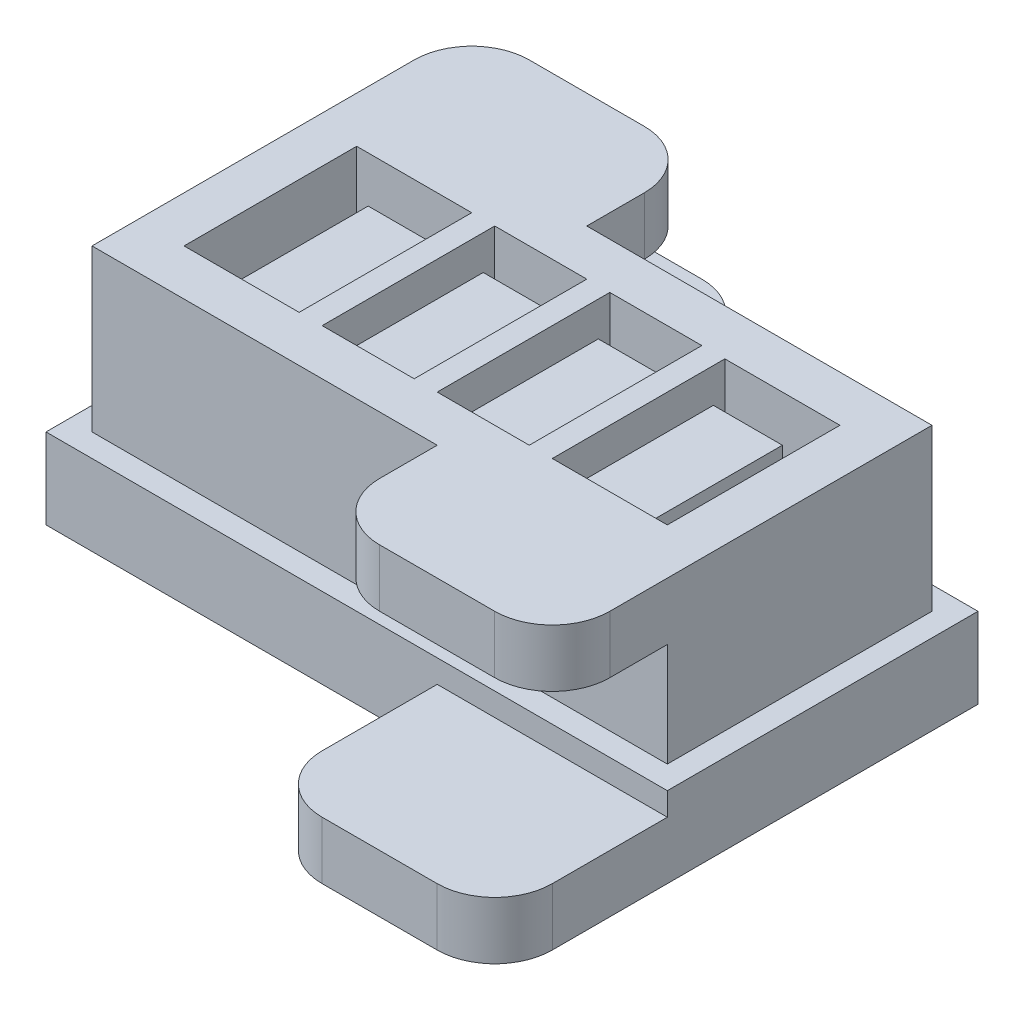
from build123d import *

# Parameters (mm, degrees)
SKETCH1_W                = 8
SKETCH1_H                = 15
BOSS_EXTRUDE1_DEPTH      = 15
SKETCH2_W                = 6
SKETCH2_H                = 11
CUT_EXTRUDE1_DEPTH       = 13
SKETCH3_W                = 15
SKETCH3_H                = 3
BOSS_EXTRUDE2_DEPTH      = 2
LPATTERN1_COUNT          = 4
LPATTERN1_PITCH          = 10
SKETCH4_W                = 15
SKETCH4_H                = 12
BOSS_EXTRUDE3_DEPTH      = 2
SKETCH5_W                = 15
SKETCH5_H                = 15
BOSS_EXTRUDE4_DEPTH      = 2
SKETCH6_W                = 36
SKETCH6_H                = 2
CUT_EXTRUDE2_DEPTH       = 2
SKETCH7_W                = 38
SKETCH7_H                = 13
SKETCH7_W_2              = 36
SKETCH7_H_2              = 11
BOSS_EXTRUDE5_DEPTH      = 2
SKETCH8_W                = 2
SKETCH8_H                = 2.5
BOSS_EXTRUDE6_DEPTH      = 2
LPATTERN2_COUNT          = 3
LPATTERN2_PITCH          = 10
BOSS_EXTRUDE7_DEPTH      = 15
BOSS_EXTRUDE7_DEPTH_BACK = 6
SKETCH9_W                = 50
SKETCH9_H                = 23
SPLIT1_START             = -6
SPLIT1_OUTLINE_W         = 50
SPLIT1_OUTLINE_H         = 23
SPLIT1_DEPTH             = 6
SPLIT1_2_OUTLINE_W       = 6
SPLIT1_2_OUTLINE_H       = 11
SPLIT1_2_DEPTH           = 13
SPLIT1_3_OUTLINE_W       = 4
SPLIT1_3_OUTLINE_H       = 2
SPLIT1_3_DEPTH           = 2
SPLIT1_START_2           = -13
SPLIT1_4_DEPTH           = 11
SPLIT1_START_3           = -19
SPLIT1_5_DEPTH           = 23
SPLIT1_6_OUTLINE_W       = 38
SPLIT1_6_OUTLINE_H       = 2
SPLIT1_6_DEPTH           = 5
SPLIT1_START_4           = -1
SPLIT1_7_OUTLINE_W       = 38
SPLIT1_7_OUTLINE_H       = 2
SPLIT1_7_DEPTH           = 5
SPLIT1_START_5           = -8.5
SPLIT1_8_DEPTH           = 2
SPLIT1_START_6           = -9.5
SPLIT1_9_OUTLINE_W       = 2
SPLIT1_9_OUTLINE_H       = 2
SPLIT1_9_DEPTH           = 4
SPLIT1_10_OUTLINE_W      = 2
SPLIT1_10_OUTLINE_H      = 2
SPLIT1_10_DEPTH          = 1
SPLIT1_START_7           = -3
SPLIT1_11_OUTLINE_W      = 2
SPLIT1_11_OUTLINE_H      = 2
SPLIT1_11_DEPTH          = 1
SKETCH11_W               = 20
SKETCH11_H               = 5
BOSS_EXTRUDE8_DEPTH      = 10
SKETCH12_W               = 20
SKETCH12_H               = 5
BOSS_EXTRUDE9_DEPTH      = 10
FILLET1_R                = 5
SKETCH13_W               = 54
SKETCH13_H               = 27
SKETCH13_W_2             = 50
SKETCH13_H_2             = 23
BOSS_EXTRUDE11_DEPTH     = 7
SKETCH14_W               = 20
SKETCH14_H               = 5
BOSS_EXTRUDE12_DEPTH     = 15
SKETCH15_W               = 20
SKETCH15_H               = 5
BOSS_EXTRUDE13_DEPTH     = 15
FILLET2_R                = 5


# Read off the part's stored shape, not the designer's step: Split1
with BuildPart() as part:
    # Sketch1 → Boss-Extrude1 (new body)
    with BuildSketch(Plane(origin=(0, 0, 0), x_dir=(1, 0, 0), z_dir=(0, 1, 0))):
        with Locations((4, 7.5)):
            Rectangle(SKETCH1_W, SKETCH1_H)
    extrude(amount=BOSS_EXTRUDE1_DEPTH)

    # Sketch2 → Cut-Extrude1 (cut)
    with BuildSketch(Plane.XZ):
        with Locations((4, -7.5)):
            Rectangle(SKETCH2_W, SKETCH2_H)
    extrude(amount=-CUT_EXTRUDE1_DEPTH, mode=Mode.SUBTRACT)

    # Sketch3 → Boss-Extrude2 (add)
    with BuildSketch(Plane.ZY):
        with Locations((-7.5, 1.5)):
            Rectangle(SKETCH3_W, SKETCH3_H)
    extrude(amount=BOSS_EXTRUDE2_DEPTH)


with BuildPart() as lpattern1_1:
    # LPattern1: pattern copy
    add(part.part.moved(Location(Vector(-1, 0, 0) * (1 * LPATTERN1_PITCH))))


with BuildPart() as lpattern1_2:
    # LPattern1: pattern copy
    add(part.part.moved(Location(Vector(-1, 0, 0) * (2 * LPATTERN1_PITCH))))


with BuildPart() as lpattern1_3:
    # LPattern1: pattern copy
    add(part.part.moved(Location(Vector(-1, 0, 0) * (3 * LPATTERN1_PITCH))))


with BuildPart() as lpattern1_2_1:
    add(lpattern1_2.part)

    # Combine1: union LPattern1_1, part, LPattern1_3
    add(lpattern1_1.part)
    add(part.part)
    add(lpattern1_3.part)

    # Sketch4 → Boss-Extrude3 (add)
    with BuildSketch(Plane.ZY.offset(30)):
        with Locations((-7.5, 9)):
            Rectangle(SKETCH4_W, SKETCH4_H)
    extrude(amount=BOSS_EXTRUDE3_DEPTH)

    # Sketch5 → Boss-Extrude4 (add)
    with BuildSketch(Plane(origin=(8, 0, 0), x_dir=(0, 0, -1), z_dir=(1, 0, 0))):
        with Locations((7.5, 7.5)):
            Rectangle(SKETCH5_W, SKETCH5_H)
    extrude(amount=BOSS_EXTRUDE4_DEPTH)

    # Sketch6 → Cut-Extrude2 (cut)
    with BuildSketch(Plane(origin=(0, 0, 0), x_dir=(-1, 0, 0), z_dir=(0, -1, 0))):
        with Locations((11, 7.5)):
            Rectangle(SKETCH6_W, SKETCH6_H)
    extrude(amount=-CUT_EXTRUDE2_DEPTH, mode=Mode.SUBTRACT)

    # Sketch7 → Boss-Extrude5 (add)
    with BuildSketch(Plane.XZ):
        with Locations((-11, -7.5)):
            Rectangle(SKETCH7_W, SKETCH7_H)
        with Locations((-11, -7.5)):
            Rectangle(SKETCH7_W_2, SKETCH7_H_2, mode=Mode.SUBTRACT)
    extrude(amount=BOSS_EXTRUDE5_DEPTH)

    # Sketch8 → Boss-Extrude6 (add)
    with BuildSketch(Plane.XZ):
        with Locations((-21, -10.75)):
            Rectangle(SKETCH8_W, SKETCH8_H)
        with Locations((-21, -4.25)):
            Rectangle(SKETCH8_W, SKETCH8_H)
    boss_extrude6 = extrude(amount=BOSS_EXTRUDE6_DEPTH)

    # LPattern2: Boss-Extrude6 ×3
    with Locations(*[(i * LPATTERN2_PITCH, 0, 0) for i in range(1, LPATTERN2_COUNT)]):
        add(boss_extrude6)


with BuildPart() as body_2:
    # Sketch9 → Boss-Extrude7 (new, two sides: drawn at the far end of the back side and taken through both)
    with BuildSketch(Plane(origin=(0, 0, 0), x_dir=(1, 0, 0), z_dir=(0, 1, 0)).offset(-BOSS_EXTRUDE7_DEPTH_BACK)):
        with Locations((-11, 7.5)):
            Rectangle(SKETCH9_W, SKETCH9_H)
    extrude(amount=BOSS_EXTRUDE7_DEPTH + BOSS_EXTRUDE7_DEPTH_BACK)

    # Combine2: cut LPattern1_2
    add(lpattern1_2_1.part, mode=Mode.SUBTRACT)

    # Split1 outline → Split1 (cut)
    with BuildSketch(Plane(origin=(0, 0, 0), x_dir=(1, 0, 0), z_dir=(0, 1, 0)).offset(SPLIT1_START)):
        with Locations((-11, 7.5)):
            Rectangle(SPLIT1_OUTLINE_W, SPLIT1_OUTLINE_H)
    extrude(amount=SPLIT1_DEPTH, mode=Mode.SUBTRACT)

    # Split1 2 outline → Split1 2 (cut)
    with BuildSketch(Plane(origin=(0, 0, 0), x_dir=(1, 0, 0), z_dir=(0, 1, 0))):
        with Locations((-26, 7.5)):
            Rectangle(SPLIT1_2_OUTLINE_W, SPLIT1_2_OUTLINE_H)
        with Locations((-16, 7.5)):
            Rectangle(SPLIT1_2_OUTLINE_W, SPLIT1_2_OUTLINE_H)
        with Locations((-6, 7.5)):
            Rectangle(SPLIT1_2_OUTLINE_W, SPLIT1_2_OUTLINE_H)
        with Locations((4, 7.5)):
            Rectangle(SPLIT1_2_OUTLINE_W, SPLIT1_2_OUTLINE_H)
    extrude(amount=SPLIT1_2_DEPTH, mode=Mode.SUBTRACT)

    # Split1 3 outline → Split1 3 (cut)
    with BuildSketch(Plane(origin=(0, 0, 0), x_dir=(1, 0, 0), z_dir=(0, 1, 0))):
        with Locations((-21, 7.5)):
            Rectangle(SPLIT1_3_OUTLINE_W, SPLIT1_3_OUTLINE_H)
        with Locations((-11, 7.5)):
            Rectangle(SPLIT1_3_OUTLINE_W, SPLIT1_3_OUTLINE_H)
        with Locations((-1, 7.5)):
            Rectangle(SPLIT1_3_OUTLINE_W, SPLIT1_3_OUTLINE_H)
    extrude(amount=SPLIT1_3_DEPTH, mode=Mode.SUBTRACT)

    # Sketch11 → Boss-Extrude8 (add)
    with BuildSketch(Plane.XY.offset(4)):
        with Locations((4, 12.5)):
            Rectangle(SKETCH11_W, SKETCH11_H)
    extrude(amount=BOSS_EXTRUDE8_DEPTH)

    # Sketch12 → Boss-Extrude9 (add)
    with BuildSketch(Plane(origin=(0, 0, -19), x_dir=(-1, 0, 0), z_dir=(0, 0, -1))):
        with Locations((26, 12.5)):
            Rectangle(SKETCH12_W, SKETCH12_H)
    extrude(amount=BOSS_EXTRUDE9_DEPTH)

    # Fillet1
    fillet1_edges = [body_2.edges().sort_by_distance(p)[0] for p in [
        (-6, 12.5, 14),
        (14, 12.5, 14),
        (-36, 12.5, -29),
        (-16, 12.5, -29),
    ]]
    fillet(fillet1_edges, radius=FILLET1_R)


with BuildPart() as body_2_2:
    # Split1 4 outline → Split1 4 (new body)
    with BuildSketch(Plane.XY.offset(SPLIT1_START_2)):
        Polygon((1, 13), (1, 0), (0, 0), (0, -2), (-2, -2), (-2, 0), (-3, 0), (-3, 13), (-9, 13), (-9, 0), (-10, 0), (-10, -2), (-12, -2), (-12, 0), (-13, 0), (-13, 13), (-19, 13), (-19, 0), (-20, 0), (-20, -2), (-22, -2), (-22, 0), (-23, 0), (-23, 13), (-29, 13), (-29, -2), (-30, -2), (-30, 0), (-36, 0), (-36, -6), (14, -6), (14, 0), (8, 0), (8, -2), (7, -2), (7, 13), align=None)
    extrude(amount=SPLIT1_4_DEPTH)

    # Split1 5 outline → Split1 5 (add)
    with BuildSketch(Plane.XY.offset(SPLIT1_START_3)):
        Polygon((8, -2), (-30, -2), (-30, 0), (-36, 0), (-36, -6), (14, -6), (14, 0), (8, 0), align=None)
    extrude(amount=SPLIT1_5_DEPTH)

    # Split1 6 outline → Split1 6 (add)
    with BuildSketch(Plane.XY.offset(SPLIT1_START_3)):
        with Locations((-11, -1)):
            Rectangle(SPLIT1_6_OUTLINE_W, SPLIT1_6_OUTLINE_H)
    extrude(amount=SPLIT1_6_DEPTH)

    # Split1 7 outline → Split1 7 (add)
    with BuildSketch(Plane.XY.offset(SPLIT1_START_4)):
        with Locations((-11, -1)):
            Rectangle(SPLIT1_7_OUTLINE_W, SPLIT1_7_OUTLINE_H)
    extrude(amount=SPLIT1_7_DEPTH)

    # Split1 8 outline → Split1 8 (add)
    with BuildSketch(Plane.XY.offset(SPLIT1_START_5)):
        Polygon((1, 0), (1, 2), (-3, 2), (-3, 0), (-2, 0), (-2, -2), (0, -2), (0, 0), align=None)
        Polygon((-10, 0), (-9, 0), (-9, 2), (-13, 2), (-13, 0), (-12, 0), (-12, -2), (-10, -2), align=None)
        Polygon((-22, -2), (-20, -2), (-20, 0), (-19, 0), (-19, 2), (-23, 2), (-23, 0), (-22, 0), align=None)
    extrude(amount=SPLIT1_8_DEPTH)

    # Split1 9 outline → Split1 9 (add)
    with BuildSketch(Plane.XY.offset(SPLIT1_START_6)):
        with Locations((-1, -1)):
            Rectangle(SPLIT1_9_OUTLINE_W, SPLIT1_9_OUTLINE_H)
        with Locations((-11, -1)):
            Rectangle(SPLIT1_9_OUTLINE_W, SPLIT1_9_OUTLINE_H)
        with Locations((-21, -1)):
            Rectangle(SPLIT1_9_OUTLINE_W, SPLIT1_9_OUTLINE_H)
    extrude(amount=SPLIT1_9_DEPTH)

    # Split1 10 outline → Split1 10 (add)
    with BuildSketch(Plane.XY.offset(SPLIT1_START_2)):
        with Locations((-1, -1)):
            Rectangle(SPLIT1_10_OUTLINE_W, SPLIT1_10_OUTLINE_H)
        with Locations((-11, -1)):
            Rectangle(SPLIT1_10_OUTLINE_W, SPLIT1_10_OUTLINE_H)
        with Locations((-21, -1)):
            Rectangle(SPLIT1_10_OUTLINE_W, SPLIT1_10_OUTLINE_H)
    extrude(amount=SPLIT1_10_DEPTH)

    # Split1 11 outline → Split1 11 (add)
    with BuildSketch(Plane.XY.offset(SPLIT1_START_7)):
        with Locations((-1, -1)):
            Rectangle(SPLIT1_11_OUTLINE_W, SPLIT1_11_OUTLINE_H)
        with Locations((-11, -1)):
            Rectangle(SPLIT1_11_OUTLINE_W, SPLIT1_11_OUTLINE_H)
        with Locations((-21, -1)):
            Rectangle(SPLIT1_11_OUTLINE_W, SPLIT1_11_OUTLINE_H)
    extrude(amount=SPLIT1_11_DEPTH)

    # Sketch13 → Boss-Extrude11 (add)
    with BuildSketch(Plane.XZ.offset(6)):
        with Locations((-11, -7.5)):
            Rectangle(SKETCH13_W, SKETCH13_H)
        with Locations((-11, -7.5)):
            Rectangle(SKETCH13_W_2, SKETCH13_H_2, mode=Mode.SUBTRACT)
    extrude(amount=-BOSS_EXTRUDE11_DEPTH)

    # Sketch14 → Boss-Extrude12 (add)
    with BuildSketch(Plane.XY.offset(6)):
        with Locations((6, -3.5)):
            Rectangle(SKETCH14_W, SKETCH14_H)
    extrude(amount=BOSS_EXTRUDE12_DEPTH)

    # Sketch15 → Boss-Extrude13 (add)
    with BuildSketch(Plane(origin=(0, 0, -21), x_dir=(-1, 0, 0), z_dir=(0, 0, -1))):
        with Locations((28, -3.5)):
            Rectangle(SKETCH15_W, SKETCH15_H)
    extrude(amount=BOSS_EXTRUDE13_DEPTH)

    # Fillet2
    fillet2_edges = [body_2_2.edges().sort_by_distance(p)[0] for p in [
        (16, -3.5, 21),
        (-4, -3.5, 21),
        (-38, -3.5, -36),
        (-18, -3.5, -36),
    ]]
    fillet(fillet2_edges, radius=FILLET2_R)


solid = Compound([body_2.part, body_2_2.part])
